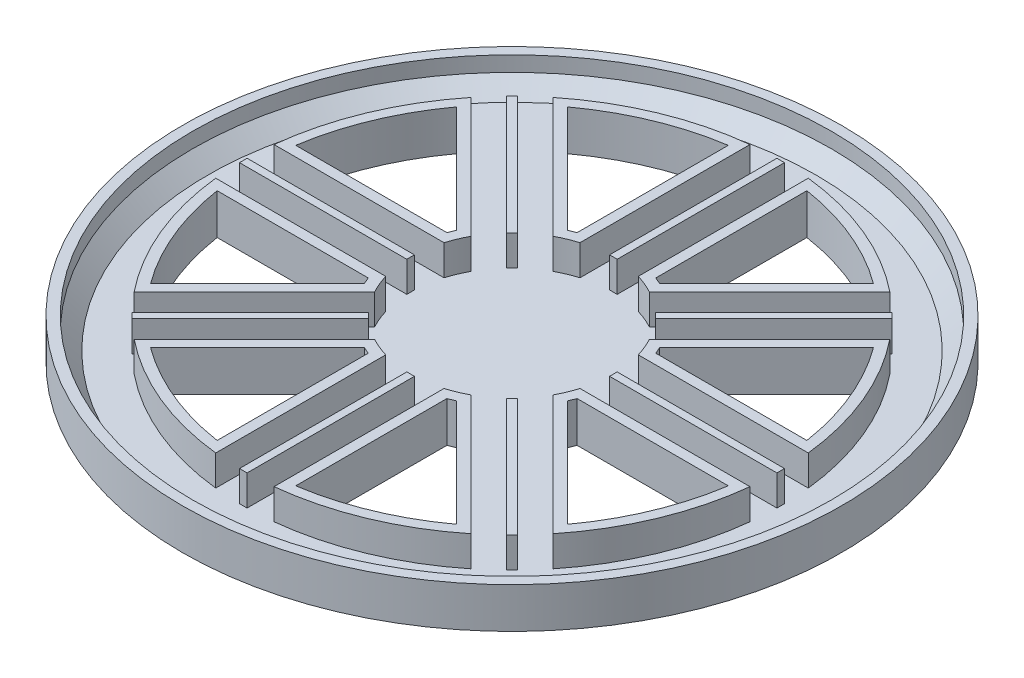
from build123d import *

# Parameters (mm, degrees)
ESQUISSE1_R                  = 65
BOSS_EXTRU_1_DEPTH           = 8
ESQUISSE2_R                  = 63
ENL_V_MAT_EXTRU_1_DEPTH      = 6
BOSS_EXTRU_2_DEPTH           = 6
R_P_TITION_CIRCULAIRE1_COUNT = 8
COQUE1_DEPTH                 = 8
CHAMFER1_SIZE                = 3


# Read off the part's stored shape, not the designer's step: Coque1
with BuildPart() as part:
    # Esquisse1 → Boss.-Extru.1 (new body)
    with BuildSketch(Plane(origin=(0, 0, 0), x_dir=(1, 0, 0), z_dir=(0, 1, 0))):
        with Locations(Location((0, 0, 0), (0, 0, 270))):
            Circle(ESQUISSE1_R)
    extrude(amount=BOSS_EXTRU_1_DEPTH)

    # Esquisse2 → Enlèv. mat.-Extru.1 (cut)
    with BuildSketch(Plane(origin=(0, 8, 0), x_dir=(1, 0, 0), z_dir=(0, 1, 0))):
        with Locations(Location((0, 0, 0), (0, 0, 270))):
            Circle(ESQUISSE2_R)
    extrude(amount=-ENL_V_MAT_EXTRU_1_DEPTH, mode=Mode.SUBTRACT)

    # Esquisse3 → Boss.-Extru.2 (add)
    with BuildSketch(Plane(origin=(0, 2, 0), x_dir=(1, 0, 0), z_dir=(0, 1, 0))):
        with BuildLine():
            Line((-41.321316613, -33.189588629), (-17.610927668, -9.479199685))
            ThreePointArc((-17.610927668, -9.479199685), (-18.47759065, -7.653668647), (-19.155612754, -5.75))
            Line((-19.155612754, -5.75), (-52.687166369, -5.75))
            ThreePointArc((-52.687166369, -5.75), (-48.965615223, -20.282221915), (-41.321316613, -33.189588629))
        make_face()
        with BuildLine():
            Line((-36.942576794, -38.003236965), (-13.60185835, -14.662518522))
            ThreePointArc((-13.60185835, -14.662518522), (-14.142135624, -14.142135624), (-14.662518522, -13.60185835))
            Line((-14.662518522, -13.60185835), (-38.003236965, -36.942576794))
            ThreePointArc((-38.003236965, -36.942576794), (-37.476659403, -37.476659403), (-36.942576794, -38.003236965))
        make_face()
    boss_extru_2 = extrude(amount=BOSS_EXTRU_2_DEPTH)

    # Répétition circulaire1: Boss.-Extru.2 ×8 about axis
    r_p_tition_circulaire1_axis = Axis((0, 0, 0), (0, 1, 0))
    for i in range(1, R_P_TITION_CIRCULAIRE1_COUNT):
        add(boss_extru_2.rotate(r_p_tition_circulaire1_axis, i * 360 / R_P_TITION_CIRCULAIRE1_COUNT))

    # Coque1 outline → Coque1 (cut)
    with BuildSketch(Plane(origin=(0, 0, 0), x_dir=(1, 0, 0), z_dir=(0, 1, 0))):
        with BuildLine():
            Line((-50.407712704, 7.75), (-20.589742592, 7.75))
            ThreePointArc((-20.589742592, 7.75), (-20.325349715, 8.419035512), (-20.039224164, 9.079069055))
            Line((-20.039224164, 9.079069055), (-41.123713031, 30.163557923))
            ThreePointArc((-41.123713031, 30.163557923), (-47.117856158, 19.516855051), (-50.407712704, 7.75))
        make_face()
        with BuildLine():
            Line((20.589742592, 7.75), (50.407712704, 7.75))
            ThreePointArc((50.407712704, 7.75), (47.117856158, 19.516855051), (41.123713031, 30.163557923))
            Line((41.123713031, 30.163557923), (20.039224164, 9.079069055))
            ThreePointArc((20.039224164, 9.079069055), (20.325349715, 8.419035512), (20.589742592, 7.75))
        make_face()
        with BuildLine():
            ThreePointArc((-7.75, 50.407712704), (-19.516855051, 47.117856158), (-30.163557923, 41.123713031))
            Line((-30.163557923, 41.123713031), (-9.079069055, 20.039224164))
            ThreePointArc((-9.079069055, 20.039224164), (-8.419035512, 20.325349715), (-7.75, 20.589742592))
            Line((-7.75, 20.589742592), (-7.75, 50.407712704))
        make_face()
        with BuildLine():
            ThreePointArc((30.163557923, 41.123713031), (19.516855051, 47.117856158), (7.75, 50.407712704))
            Line((7.75, 50.407712704), (7.75, 20.589742592))
            ThreePointArc((7.75, 20.589742592), (8.419035512, 20.325349715), (9.079069055, 20.039224164))
            Line((9.079069055, 20.039224164), (30.163557923, 41.123713031))
        make_face()
        with BuildLine():
            ThreePointArc((41.123713031, -30.163557923), (47.117856158, -19.516855051), (50.407712704, -7.75))
            Line((50.407712704, -7.75), (20.589742592, -7.75))
            ThreePointArc((20.589742592, -7.75), (20.325349715, -8.419035512), (20.039224164, -9.079069055))
            Line((20.039224164, -9.079069055), (41.123713031, -30.163557923))
        make_face()
        with BuildLine():
            ThreePointArc((7.75, -50.407712704), (19.516855051, -47.117856158), (30.163557923, -41.123713031))
            Line((30.163557923, -41.123713031), (9.079069055, -20.039224164))
            ThreePointArc((9.079069055, -20.039224164), (8.419035512, -20.325349715), (7.75, -20.589742592))
            Line((7.75, -20.589742592), (7.75, -50.407712704))
        make_face()
        with BuildLine():
            ThreePointArc((-30.163557923, -41.123713031), (-19.516855051, -47.117856158), (-7.75, -50.407712704))
            Line((-7.75, -50.407712704), (-7.75, -20.589742592))
            ThreePointArc((-7.75, -20.589742592), (-8.419035512, -20.325349715), (-9.079069055, -20.039224164))
            Line((-9.079069055, -20.039224164), (-30.163557923, -41.123713031))
        make_face()
        with BuildLine():
            ThreePointArc((-50.407712704, -7.75), (-47.117856158, -19.516855051), (-41.123713031, -30.163557923))
            Line((-41.123713031, -30.163557923), (-20.039224164, -9.079069055))
            ThreePointArc((-20.039224164, -9.079069055), (-20.325349715, -8.419035512), (-20.589742592, -7.75))
            Line((-20.589742592, -7.75), (-50.407712704, -7.75))
        make_face()
    extrude(amount=COQUE1_DEPTH, mode=Mode.SUBTRACT)

    # Chamfer1
    chamfer1_edges = [part.edges().sort_by_distance(p)[0] for p in [
        (0, 2, -63),
    ]]
    chamfer(chamfer1_edges, length=CHAMFER1_SIZE)


solid = part.part
